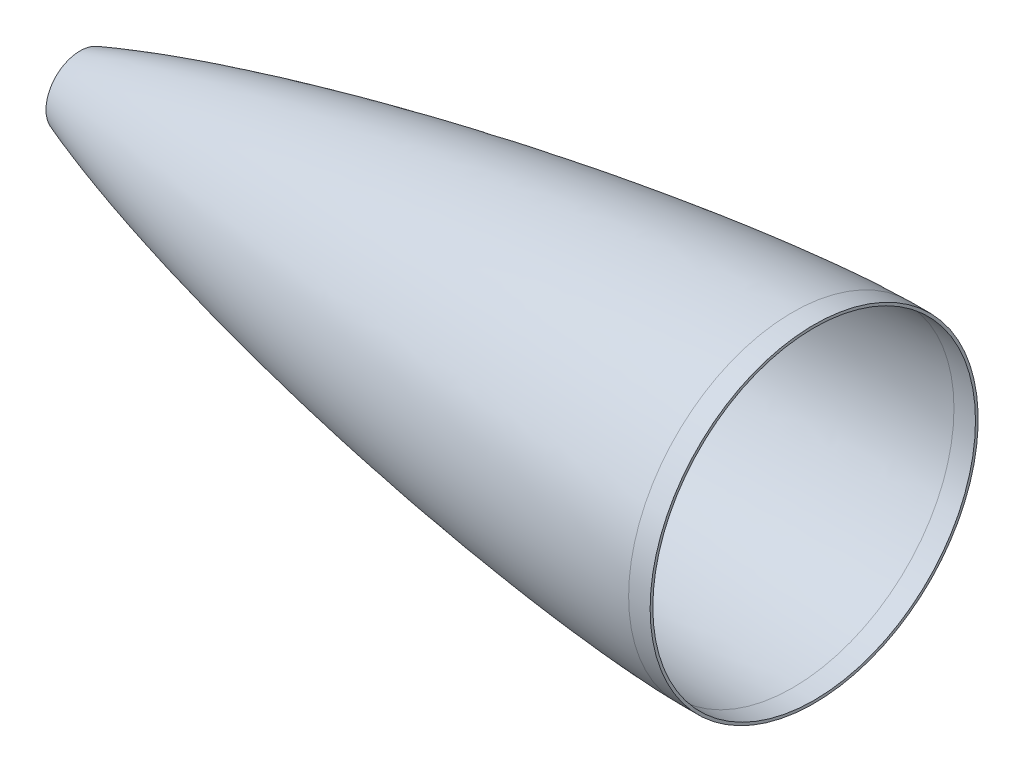
from build123d import *

# Parameters (mm, degrees)
SKETCH2_R          = 96.8375
CUT_EXTRUDE1_DEPTH = 38.1


with BuildPart() as part:
    # Sketch1 → Revolve3 (revolve)
    with BuildSketch(Plane.XY):
        with BuildLine():
            Line((457.2, 95.25), (469.896281998, 95.25))
            Line((469.896281998, 95.25), (469.896281998, 96.8375))
            Line((469.896281998, 96.8375), (457.196281998, 96.8375))
            add(Edge.make_bspline(
                [(-1.613027701, 0), (-1.612711878, 0.00175474), (-1.605563851, 0.041446569), (-1.594988186, 0.100149739), (-1.581389731, 0.175782501), (-1.572707122, 0.223728678), (-1.566997167, 0.255936942), (-1.563638571, 0.273894792), (-1.562530166, 0.281172056), (-1.54113805, 0.391845853), (-1.506748162, 0.514869843), (-1.441006297, 0.695544345), (-1.388645233, 0.806113014), (-1.305801045, 0.968259164), (-1.213168713, 1.120857252), (-1.072817399, 1.329577523), (-0.905983242, 1.546851815), (-0.710549212, 1.776732498), (-0.51743848, 1.986597944), (-0.260869397, 2.248696572), (0.059240882, 2.551506213), (0.444273305, 2.889775507), (0.960794747, 3.31752069), (1.611107989, 3.817847959), (2.399945553, 4.382869642), (3.459963218, 5.09973513), (4.800955867, 5.94461061), (6.97048626, 7.218451099), (9.720437652, 8.702577269), (13.059488776, 10.368335632), (17.554227076, 12.474552049), (23.231330402, 14.936988035), (30.109282575, 17.703427282), (37.034664222, 20.324531793), (43.998739715, 22.827822111), (53.325878023, 26.031673422), (65.048289722, 29.824948589), (79.192461596, 34.109751932), (93.397633025, 38.171640178), (107.653121858, 42.042021616), (121.951053653, 45.743284615), (141.064458448, 50.474273797), (165.03776907, 56.037803904), (193.911776008, 62.2236635), (222.876667343, 67.959465053), (251.92166464, 73.268981195), (281.039554234, 78.161617777), (310.225321028, 82.634691682), (339.475870497, 86.672057689), (368.790008375, 90.240078055), (393.271656318, 92.773167666), (412.891914508, 94.477240181), (427.624405065, 95.565697791), (439.924064117, 96.284968563), (449.769524012, 96.687456769), (454.72263814, 96.825913148), (457.196281998, 96.8375)],
                knots=[-0.000606109, -0.000606109, -0.000606109, -0.000606109, -0.000594771, -0.000349645, -0.000227082, -0.00010452, -4.3238e-05, -1.2597e-05, 2.723e-06, 1.8043e-05, 7.9325e-05, 0.000140606, 0.000263169, 0.000385732, 0.000630857, 0.000875983, 0.001366234, 0.001856485, 0.002346736, 0.002836988, 0.00381749, 0.004797992, 0.005778495, 0.0077395, 0.009700504, 0.011661509, 0.015583519, 0.019505528, 0.027349547, 0.035193566, 0.043037585, 0.058725623, 0.074413661, 0.090101699, 0.105789738, 0.121477776, 0.152853852, 0.184229928, 0.215606004, 0.24698208, 0.278358156, 0.309734233, 0.372486385, 0.435238537, 0.49799069, 0.560742842, 0.623494994, 0.686247146, 0.748999299, 0.811751451, 0.874503603, 0.90587968, 0.937255756, 0.968631832, 0.98431987, 1.000007908, 1.000007908, 1.000007908, 1.000007908], degree=3))
            Line((-1.613027701, 0), (0, 0))
            add(Edge.make_bspline(
                [(0, 0), (0.002261413, 0.012559634), (0.008229149, 0.03727132), (0.026197477, 0.085010802), (0.070593088, 0.176725307), (0.135390602, 0.284235785), (0.220401303, 0.406590084), (0.336037993, 0.556544126), (0.508304998, 0.760811711), (0.80208614, 1.073293742), (1.325080854, 1.565169332), (2.238118633, 2.319225256), (3.825271995, 3.466618443), (6.613989832, 5.225294798), (11.456120137, 7.876617711), (19.293604572, 11.601746405), (32.615554098, 17.130480015), (51.688271319, 23.981890995), (75.613057969, 31.54621241), (103.310212008, 39.361975261), (131.892371678, 46.686426538), (160.614305524, 53.440297164), (189.44815344, 59.696867207), (218.376688059, 65.499444524), (247.387631707, 70.874021631), (276.472706829, 75.831796355), (305.625866717, 80.372187528), (334.843049411, 84.481216859), (364.121565724, 88.129371268), (389.792768776, 90.870557363), (411.834102605, 92.837355417), (428.995077346, 94.067568174), (440.032338735, 94.69756489), (448.618051981, 95.062046142), (453.521410507, 95.200160943), (455.973700484, 95.244255862), (457.2, 95.25)],
                knots=[0, 0, 0, 0, 0, 0.000108244, 0.000216487, 0.000432974, 0.000865949, 0.001174715, 0.001483481, 0.002043604, 0.003138685, 0.004821522, 0.007588035, 0.012111566, 0.019790706, 0.032854349, 0.05452956, 0.085906528, 0.142462243, 0.205216412, 0.267970588, 0.330724763, 0.393478942, 0.456233118, 0.518987298, 0.581741474, 0.644495652, 0.707249831, 0.770004011, 0.832758189, 0.895512367, 0.926889456, 0.958266545, 0.979133273, 0.989566636, 1, 1, 1, 1, 1], degree=4))
        make_face()
    revolve(axis=Axis((0, 0, 0), (1, 0, 0)))

    # Sketch2 → Cut-Extrude1 (cut)
    with BuildSketch(Plane(origin=(-1.613027875, 0, 0), x_dir=(0, 0, -1), z_dir=(1, 0, 0))):
        Circle(SKETCH2_R)
    extrude(amount=CUT_EXTRUDE1_DEPTH, mode=Mode.SUBTRACT)


solid = part.part
